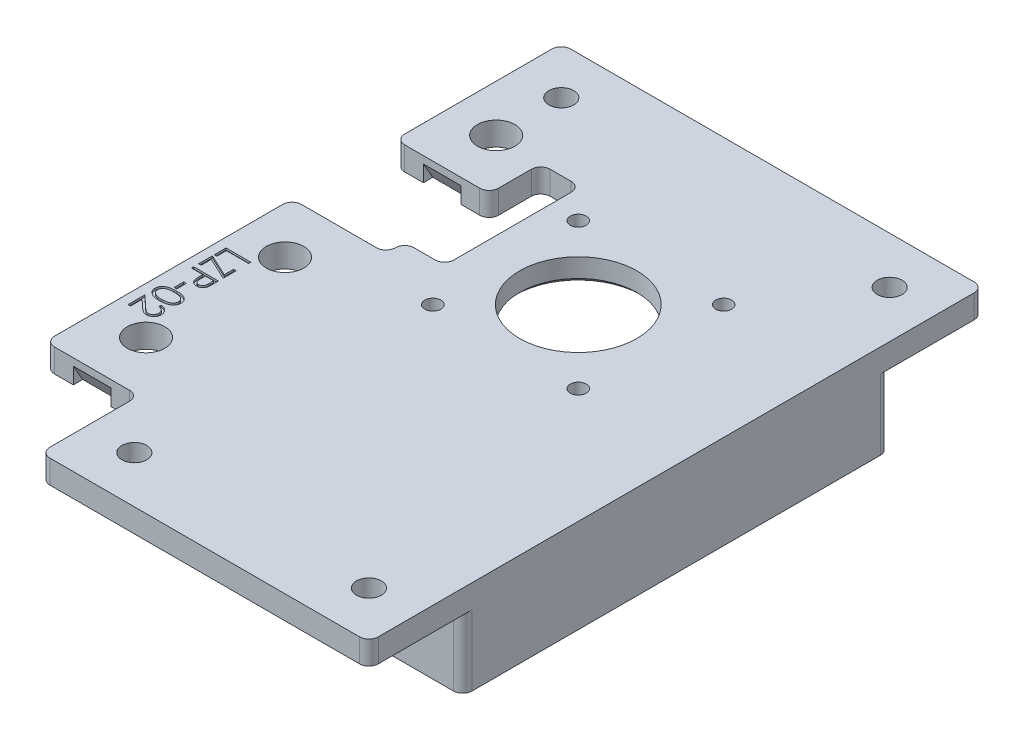
from build123d import *

# Parameters (mm, degrees)
SKETCH1_W               = 90
SKETCH1_H               = 131
BOSS_EXTRUDE1_DEPTH     = 5
CUT_EXTRUDE1_REACH      = 161.016
SKETCH2_R               = 12.5
SKETCH2_R_2             = 1.7
SKETCH2_W               = 20
SKETCH2_H               = 20
M5_CLEARANCE_HOLE1_D    = 5.3
SKETCH6_R               = 4
CUT_EXTRUDE2_DEPTH      = 10
MOVE_FACE1_BY           = 1
MOVE_FACE1_2_BY         = 1
MOVE_FACE1_3_BY         = 1
BOSS_EXTRUDE2_DEPTH     = 15
FILLET4_R               = 3
FILLET5_R               = 2
CUT_EXTRUDE5_DEPTH      = 4
CUT_EXTRUDE5_DEPTH_BACK = 4
SKETCH11_W              = 8.5
SKETCH11_H              = 15
CUT_EXTRUDE6_DEPTH      = 161.190511579
FILLET6_R               = 2
CHAMFER1_SIZE           = 1
SKETCH12_W              = 0.542735043
SKETCH12_H              = 2.03525641
CUT_EXTRUDE7_DEPTH      = 0.4


# Some blends are built 0.0001 mm under size
with BuildPart() as part:
    # Sketch1 → Boss-Extrude1 (new body)
    with BuildSketch(Plane(origin=(0, 0, 0), x_dir=(1, 0, 0), z_dir=(0, 1, 0))):
        with Locations((45, 65.5)):
            Rectangle(SKETCH1_W, SKETCH1_H)
    extrude(amount=BOSS_EXTRUDE1_DEPTH)

    # Sketch2 → Cut-Extrude1 (cut, up to next)
    with BuildSketch(Plane(origin=(0, 5, 0), x_dir=(1, 0, 0), z_dir=(0, 1, 0)), mode=Mode.PRIVATE) as cut_extrude1_sk1:
        with Locations(Location((50, 84.625, 0), (0, 0, 270))):
            Circle(SKETCH2_R)
    cut_extrude1_tool1 = extrude(cut_extrude1_sk1.sketch, amount=-CUT_EXTRUDE1_REACH, mode=Mode.PRIVATE) & part.part
    # Sketch2 → Cut-Extrude1 (cut, up to next)
    with BuildSketch(Plane(origin=(0, 5, 0), x_dir=(1, 0, 0), z_dir=(0, 1, 0)), mode=Mode.PRIVATE) as cut_extrude1_sk2:
        with Locations(Location((65.5, 100.125, 0), (0, 0, 270))):
            Circle(SKETCH2_R_2)
    cut_extrude1_tool2 = extrude(cut_extrude1_sk2.sketch, amount=-CUT_EXTRUDE1_REACH, mode=Mode.PRIVATE) & part.part
    # Sketch2 → Cut-Extrude1 (cut, up to next)
    with BuildSketch(Plane(origin=(0, 5, 0), x_dir=(1, 0, 0), z_dir=(0, 1, 0)), mode=Mode.PRIVATE) as cut_extrude1_sk3:
        with Locations(Location((34.5, 100.125, 0), (0, 0, 270))):
            Circle(SKETCH2_R_2)
    cut_extrude1_tool3 = extrude(cut_extrude1_sk3.sketch, amount=-CUT_EXTRUDE1_REACH, mode=Mode.PRIVATE) & part.part
    # Sketch2 → Cut-Extrude1 (cut, up to next)
    with BuildSketch(Plane(origin=(0, 5, 0), x_dir=(1, 0, 0), z_dir=(0, 1, 0)), mode=Mode.PRIVATE) as cut_extrude1_sk4:
        with Locations(Location((65.5, 69.125, 0), (0, 0, 270))):
            Circle(SKETCH2_R_2)
    cut_extrude1_tool4 = extrude(cut_extrude1_sk4.sketch, amount=-CUT_EXTRUDE1_REACH, mode=Mode.PRIVATE) & part.part
    # Sketch2 → Cut-Extrude1 (cut, up to next)
    with BuildSketch(Plane(origin=(0, 5, 0), x_dir=(1, 0, 0), z_dir=(0, 1, 0)), mode=Mode.PRIVATE) as cut_extrude1_sk5:
        with Locations(Location((34.5, 69.125, 0), (0, 0, 270))):
            Circle(SKETCH2_R_2)
    cut_extrude1_tool5 = extrude(cut_extrude1_sk5.sketch, amount=-CUT_EXTRUDE1_REACH, mode=Mode.PRIVATE) & part.part
    # Sketch2 → Cut-Extrude1 (cut, up to next)
    with BuildSketch(Plane(origin=(0, 5, 0), x_dir=(1, 0, 0), z_dir=(0, 1, 0)), mode=Mode.PRIVATE) as cut_extrude1_sk6:
        Polygon((0, 94.625), (20, 94.625), (20, 91.625), (28.5, 91.625), (28.5, 77.625), (20, 77.625), (20, 74.625), (0, 74.625), align=None)
    cut_extrude1_tool6 = extrude(cut_extrude1_sk6.sketch, amount=-CUT_EXTRUDE1_REACH, mode=Mode.PRIVATE) & part.part
    # Sketch2 → Cut-Extrude1 (cut, up to next)
    with BuildSketch(Plane(origin=(0, 5, 0), x_dir=(1, 0, 0), z_dir=(0, 1, 0)), mode=Mode.PRIVATE) as cut_extrude1_sk7:
        with Locations((10, 10)):
            Rectangle(SKETCH2_W, SKETCH2_H)
    cut_extrude1_tool7 = extrude(cut_extrude1_sk7.sketch, amount=-CUT_EXTRUDE1_REACH, mode=Mode.PRIVATE) & part.part
    add(cut_extrude1_tool1.solids().sort_by_distance((50, 5, -84.625))[0], mode=Mode.SUBTRACT)
    add(cut_extrude1_tool2.solids().sort_by_distance((65.5, 5, -100.125))[0], mode=Mode.SUBTRACT)
    add(cut_extrude1_tool3.solids().sort_by_distance((34.5, 5, -100.125))[0], mode=Mode.SUBTRACT)
    add(cut_extrude1_tool4.solids().sort_by_distance((65.5, 5, -69.125))[0], mode=Mode.SUBTRACT)
    add(cut_extrude1_tool5.solids().sort_by_distance((34.5, 5, -69.125))[0], mode=Mode.SUBTRACT)
    add(cut_extrude1_tool6.solids().sort_by_distance((13.267341, 5, -84.625))[0], mode=Mode.SUBTRACT)
    add(cut_extrude1_tool7.solids().sort_by_distance((10, 5, -10))[0], mode=Mode.SUBTRACT)

    # M5 Clearance Hole1 (through all)
    with Locations(Plane(origin=(0, 5, 0), x_dir=(1, 0, 0), z_dir=(0, 1, 0))):
        with Locations((80, 10), (10, 121), (80, 121), (30, 10)):
            Hole(M5_CLEARANCE_HOLE1_D / 2)

    # Sketch6 → Cut-Extrude2 (cut)
    with BuildSketch(Plane(origin=(0, 0, 0), x_dir=(-1, 0, 0), z_dir=(0, -1, 0))):
        with Locations(Location((-10, 32.5, 0), (0, 0, 90))):
            Circle(SKETCH6_R)
        with Locations(Location((-10, 62.125, 0), (0, 0, 90))):
            Circle(SKETCH6_R)
        with Locations(Location((-10, 107.125, 0), (0, 0, 90))):
            Circle(SKETCH6_R)
    extrude(amount=-CUT_EXTRUDE2_DEPTH, mode=Mode.SUBTRACT)

    # Move Face1: a face moved inward by 1.0
    extrude(part.faces().sort_by_distance((10, 2.5, -20))[0], amount=MOVE_FACE1_BY, dir=(0, 0, -1), mode=Mode.SUBTRACT)

    # Move Face1 2: a face moved inward by 1.0
    extrude(part.faces().sort_by_distance((10, 2.5, -94.625))[0], amount=MOVE_FACE1_2_BY, dir=(0, 0, -1), mode=Mode.SUBTRACT)

    # Move Face1 3: a face moved inward by 1.0
    extrude(part.faces().sort_by_distance((10, 2.5, -74.625))[0], amount=MOVE_FACE1_3_BY, dir=(0, 0, 1), mode=Mode.SUBTRACT)

    # Sketch9 → Boss-Extrude2 (add)
    with BuildSketch(Plane.XZ):
        Polygon((90, -111), (90, -20), (20, -20), (20, -73.625), (25, -73.625), (25, -25), (85, -25), (85, -106), (71, -106), (71, -111), align=None)
    extrude(amount=BOSS_EXTRUDE2_DEPTH)

    # Fillet4
    fillet4_edges = [part.edges().sort_by_distance(p)[0] for p in [
        (25, -7.5, -25),
        (85, -7.5, -25),
        (85, -7.5, -106),
    ]]
    fillet(fillet4_edges, radius=FILLET4_R)

    # Fillet5
    # the kernel refuses this fillet: 2 mm, written as the material it takes off along each edge
    with BuildSketch(Plane(origin=(71, 0, -111), x_dir=(0, 0, 1), z_dir=(0, -1, 0)), Plane(origin=(90, 0, -111), x_dir=(-1, 0, 0), z_dir=(0, -1, 0)), Plane(origin=(90, 0, -20), x_dir=(0, 0, -1), z_dir=(0, -1, 0)), Plane(origin=(20, 0, -20), x_dir=(1, 0, 0), z_dir=(0, -1, 0)), Plane(origin=(71, 0, -106), x_dir=(1, 0, 0), z_dir=(0, -1, 0))) as fillet5_piece_1:
        with BuildLine():
            CenterArc((FILLET5_R, -FILLET5_R), FILLET5_R, 90, 90)
            Line((0, -FILLET5_R), (0, 0))
            Line((0, 0), (FILLET5_R, 0))
        make_face()
    extrude(amount=20, mode=Mode.SUBTRACT)
    with BuildSketch(Plane(origin=(20, 0, -73.625), x_dir=(1, 0, 0), z_dir=(0, -1, 0)), Plane(origin=(25, 0, -73.625), x_dir=(0, 0, 1), z_dir=(0, -1, 0))) as fillet5_piece_2:
        with BuildLine():
            CenterArc((FILLET5_R, FILLET5_R), FILLET5_R, 180, 90)
            Line((0, FILLET5_R), (0, 0))
            Line((0, 0), (FILLET5_R, 0))
        make_face()
    extrude(amount=20, mode=Mode.SUBTRACT)

    # Sketch10 → Cut-Extrude5 (cut, two sides: drawn at the far end of the back side and taken through both)
    with BuildSketch(Plane.ZY.offset(-10).offset(-CUT_EXTRUDE5_DEPTH_BACK)):
        Polygon((-73.625, 0), (-73.625, 3.464101615), (-71.625, 0), align=None)
        Polygon((-97.625, 0), (-95.625, 0), (-95.625, 3.464101615), align=None)
        Polygon((-21, 0), (-23, 0), (-21, 3.464101615), align=None)
    extrude(amount=CUT_EXTRUDE5_DEPTH + CUT_EXTRUDE5_DEPTH_BACK, mode=Mode.SUBTRACT)

    # Sketch11 → Cut-Extrude6 (cut, through all)
    with BuildSketch(Plane(origin=(0, 5, 0), x_dir=(1, 0, 0), z_dir=(0, 1, 0))):
        with Locations((24.25, 99.125)):
            Rectangle(SKETCH11_W, SKETCH11_H)
    extrude(amount=-CUT_EXTRUDE6_DEPTH, mode=Mode.SUBTRACT)

    # Fillet6
    fillet6_edges = [part.edges().sort_by_distance(p)[0] for p in [
        (20, 2.5, -106.625),
        (28.5, 2.5, -106.625),
        (0, 2.5, -21),
        (20, 2.5, -21),
        (20, 2.5, 0),
        (0, 2.5, -73.625),
        (0, 2.5, -95.625),
        (20, 2.5, -95.625),
        (28.5, 2.5, -77.625),
        (20, 2.5, -77.625),
        (20, 2.5, -73.625),
        (0, 2.5, -131),
        (90, 2.5, -131),
        (90, 2.5, 0),
    ]]
    fillet(fillet6_edges, radius=FILLET6_R - 0.0001)  # a hair under: the kernel refuses the full size

    # Chamfer1
    chamfer1_edges = [part.edges().sort_by_distance(p)[0] for p in [
        (50, 0, -97.125),
    ]]
    chamfer(chamfer1_edges, length=CHAMFER1_SIZE)

    # Sketch12 → Cut-Extrude7 (cut)
    # profile 1 of 6: a face of its own
    with BuildSketch(Plane(origin=(0, 5, 0), x_dir=(1, 0, 0), z_dir=(0, 1, 0))):
        Polygon((7.291666667, 57.556623932), (7.291666667, 57.081730769), (2.542735043, 57.081730769), (2.542735043, 55.046474359), (2, 55.046474359), (2, 57.556623932), align=None)
    # profile 2 of 6: a face of its own
    with BuildSketch(Plane(origin=(0, 5, 0), x_dir=(1, 0, 0), z_dir=(0, 1, 0))):
        Polygon((6.748931624, 54.435897436), (7.291666667, 54.435897436), (7.291666667, 51.654380342), (2.542735043, 53.874081864), (2.542735043, 51.722222222), (2, 51.722222222), (2, 54.639423077), (6.748931624, 52.419721554), align=None)
    # profile 3 of 6: a face of its own
    with BuildSketch(Plane(origin=(0, 5, 0), x_dir=(1, 0, 0), z_dir=(0, 1, 0))):
        with BuildLine():
            Line((7.291666667, 50.636752137), (7.291666667, 49.598983373))
            add(Edge.make_bspline(
                [(7.291666667, 49.598983373), (7.291588204, 49.52760498), (7.291437867, 49.390840807), (7.286879859, 49.194723997), (7.280791884, 49.016606902), (7.272352593, 48.856873588), (7.262379177, 48.715032583), (7.248390974, 48.591725713), (7.233785528, 48.485983765), (7.218936496, 48.422625205), (7.212164463, 48.393729968)],
                knots=[0, 0, 0, 0, 1.415646017, 2.712440637, 3.8905458, 4.950247383, 5.884950622, 6.709939814, 7.411656543, 8, 8, 8, 8], degree=3))
            add(Edge.make_bspline(
                [(7.212164463, 48.393729968), (7.202152795, 48.357151563), (7.182365371, 48.284856676), (7.142731425, 48.180686111), (7.095742949, 48.081570302), (7.042167591, 47.987196876), (6.979813317, 47.898623436), (6.910652572, 47.814716183), (6.834723407, 47.734993849), (6.750553877, 47.662164576), (6.66124729, 47.595115881), (6.564814737, 47.537598271), (6.463355039, 47.488945967), (6.355829122, 47.449211852), (6.242890501, 47.418998598), (6.124209473, 47.396676092), (6.000193835, 47.382393875), (5.915434848, 47.381034093), (5.872287326, 47.38034188)],
                knots=[0, 0, 0, 0, 0.999487232, 1.975422798, 2.933948774, 3.889618007, 4.832992075, 5.786114792, 6.754729845, 7.731954186, 8.717668599, 9.695514499, 10.68728626, 11.680675814, 12.71351902, 13.766008651, 14.862761406, 16, 16, 16, 16], degree=3))
            add(Edge.make_bspline(
                [(5.872287326, 47.38034188), (5.828778069, 47.380979034), (5.743649267, 47.382225669), (5.619109456, 47.39718791), (5.500094748, 47.41734189), (5.386869031, 47.448331481), (5.280104711, 47.488919582), (5.178170229, 47.536532567), (5.082799773, 47.593960048), (4.993647107, 47.659946873), (4.910628549, 47.73335226), (4.834345705, 47.813865631), (4.765245098, 47.901161942), (4.703171817, 47.994963761), (4.649565299, 48.096185557), (4.601551279, 48.203292146), (4.561227175, 48.317214497), (4.540015058, 48.396049012), (4.529230101, 48.436131143)],
                knots=[0, 0, 0, 0, 1.121902311, 2.195077645, 3.232258892, 4.234102512, 5.217864754, 6.176164875, 7.132989551, 8.084763148, 9.034132444, 9.988522005, 10.94243251, 11.903244335, 12.886203696, 13.894208494, 14.929344452, 16, 16, 16, 16], degree=3))
            add(Edge.make_bspline(
                [(4.529230101, 48.436131143), (4.522180118, 48.469283184), (4.50672967, 48.541937809), (4.48948117, 48.661594067), (4.474758845, 48.800909115), (4.46372022, 48.9596928), (4.454270258, 49.137802597), (4.446758973, 49.335334855), (4.442631694, 49.552677329), (4.442418829, 49.7042779), (4.442307692, 49.783428486)],
                knots=[0, 0, 0, 0, 0.601384939, 1.31797006, 2.144135048, 3.087295005, 4.142315834, 5.309527816, 6.595305764, 8, 8, 8, 8], degree=3))
            Line((4.442307692, 49.783428486), (4.442307692, 50.161858974))
            Line((4.442307692, 50.161858974), (2, 50.161858974))
            Line((2, 50.161858974), (2, 50.636752137))
            Line((2, 50.636752137), (7.291666667, 50.636752137))
        make_face()
        with BuildLine():
            Line((6.748931624, 50.161858974), (4.985042735, 50.161858974))
            Line((4.985042735, 50.161858974), (4.973382412, 49.235393296))
            add(Edge.make_bspline(
                [(4.973382412, 49.235393296), (4.973354123, 49.190156775), (4.973299513, 49.102828605), (4.979407465, 48.976334594), (4.986144945, 48.859278395), (4.996696128, 48.751405801), (5.010598304, 48.653541183), (5.025730557, 48.564427502), (5.046231747, 48.485369336), (5.074817398, 48.392727642), (5.122620583, 48.289846912), (5.193796037, 48.178666681), (5.282030895, 48.08291784), (5.382600659, 48.000614523), (5.49488718, 47.936829671), (5.614084563, 47.888855329), (5.740267811, 47.860910551), (5.826573075, 47.85713974), (5.870167268, 47.855235043)],
                knots=[0, 0, 0, 0, 1.160368111, 2.240066715, 3.248291599, 4.168343349, 5.019594299, 5.784185847, 6.485545725, 7.113397927, 8.269509094, 9.383373363, 10.487084095, 11.595623793, 12.704274681, 13.786671823, 14.88201193, 16, 16, 16, 16], degree=3))
            add(Edge.make_bspline(
                [(5.870167268, 47.855235043), (5.912706714, 47.857149911), (5.997269869, 47.860956433), (6.121262723, 47.889075755), (6.239195467, 47.93673602), (6.350099601, 48.001046739), (6.450257782, 48.080986866), (6.536501316, 48.174613823), (6.606774651, 48.280015809), (6.651819116, 48.378113007), (6.679367747, 48.465192781), (6.698634582, 48.540838214), (6.71401981, 48.626246141), (6.726476944, 48.72144761), (6.73714117, 48.825703719), (6.744377092, 48.939910474), (6.748612633, 49.063635144), (6.748822719, 49.149527317), (6.748931624, 49.19405215)],
                knots=[0, 0, 0, 0, 1.120550889, 2.227516482, 3.330715807, 4.461473166, 5.594337325, 6.694900473, 7.802844763, 8.919519911, 9.52614448, 10.208195984, 10.975273469, 11.811520316, 12.738076669, 13.736566072, 14.826679847, 16, 16, 16, 16], degree=3))
            Line((6.748931624, 49.19405215), (6.748931624, 50.161858974))
        make_face(mode=Mode.SUBTRACT)
    # profile 4 of 6: a face of its own
    with BuildSketch(Plane(origin=(0, 5, 0), x_dir=(1, 0, 0), z_dir=(0, 1, 0))):
        with Locations((4.035256411, 45.752136752)):
            Rectangle(SKETCH12_W, SKETCH12_H)
    # profile 5 of 6: a face of its own
    with BuildSketch(Plane(origin=(0, 5, 0), x_dir=(1, 0, 0), z_dir=(0, 1, 0))):
        with BuildLine():
            add(Edge.make_bspline(
                [(4.643713275, 44.327457265), (4.728527182, 44.326961333), (4.89327942, 44.325997977), (5.133346677, 44.31528096), (5.358560448, 44.297477765), (5.568931508, 44.27307959), (5.764514188, 44.243388847), (5.944785745, 44.203753484), (6.11058076, 44.158679512), (6.262439122, 44.106439014), (6.40240934, 44.047494882), (6.533070555, 43.983332352), (6.654256881, 43.911440079), (6.767788862, 43.835804078), (6.872399426, 43.753660409), (6.967890466, 43.665875484), (7.054319642, 43.571578514), (7.132715607, 43.472634476), (7.201008487, 43.368418073), (7.262544911, 43.262141949), (7.313051617, 43.151930775), (7.354551921, 43.038789712), (7.387805062, 42.923047786), (7.410832799, 42.804226761), (7.425264999, 42.682297931), (7.426648689, 42.60000371), (7.427350427, 42.558268229)],
                knots=[0, 0, 0, 0, 1.646377244, 3.198111528, 4.663803227, 6.031090796, 7.308794487, 8.502186765, 9.612154809, 10.642545331, 11.617106989, 12.558866172, 13.465886467, 14.35053239, 15.20542558, 16.045215227, 16.865619885, 17.686225247, 18.492864914, 19.282407821, 20.068097601, 20.842842034, 21.620163247, 22.403093475, 23.190129512, 24, 24, 24, 24], degree=3))
            add(Edge.make_bspline(
                [(7.427350427, 42.558268229), (7.426612897, 42.516183637), (7.425146182, 42.432490623), (7.411049269, 42.30875577), (7.387658404, 42.187879466), (7.354515978, 42.070377042), (7.313398705, 41.955283312), (7.261862231, 41.843498505), (7.201871562, 41.734328275), (7.1313807, 41.629507483), (7.052788449, 41.527885386), (6.96394489, 41.431958109), (6.8657471, 41.341716919), (6.759245711, 41.256029255), (6.642398023, 41.17732615), (6.517236333, 41.102375842), (6.381571812, 41.035289549), (6.237668009, 40.97067879), (6.081543192, 40.914909179), (5.914077423, 40.864613785), (5.73329264, 40.823975344), (5.540137365, 40.790124897), (5.333902241, 40.763901066), (5.115029359, 40.744801714), (4.883374721, 40.734712645), (4.72499083, 40.732812633), (4.643713275, 40.731837607)],
                knots=[0, 0, 0, 0, 0.810914788, 1.612654377, 2.396697861, 3.181598691, 3.963628158, 4.749916497, 5.551656086, 6.361998678, 7.18212741, 8.025565596, 8.878627764, 9.750805457, 10.657531673, 11.591944965, 12.560506719, 13.57287815, 14.630710178, 15.753379473, 16.941251878, 18.199788006, 19.531962791, 20.947069417, 22.433333509, 24, 24, 24, 24], degree=3))
            add(Edge.make_bspline(
                [(4.643713275, 40.731837607), (4.562790526, 40.732823958), (4.40511585, 40.734745824), (4.174499362, 40.74467538), (3.956802721, 40.764326695), (3.751419943, 40.788632271), (3.559570451, 40.823255229), (3.379429989, 40.86261543), (3.212553139, 40.911535935), (3.057251711, 40.966545404), (2.914052944, 41.029754174), (2.779561178, 41.097433385), (2.654501615, 41.171923633), (2.537655626, 41.251096105), (2.430230593, 41.336055435), (2.331961019, 41.426678742), (2.242911721, 41.523035007), (2.163245654, 41.624886861), (2.093575355, 41.731356631), (2.031301313, 41.840162465), (1.980769791, 41.953476029), (1.938105046, 42.06877902), (1.904886375, 42.187159399), (1.882141775, 42.308501048), (1.866145909, 42.43240658), (1.864928241, 42.516169077), (1.864316239, 42.558268229)],
                knots=[0, 0, 0, 0, 1.56130642, 3.042141888, 4.451772327, 5.777565838, 7.030558081, 8.211376819, 9.333164717, 10.383253789, 11.387583522, 12.350962576, 13.286244149, 14.193812918, 15.072134482, 15.925989337, 16.770211267, 17.600669898, 18.417446232, 19.22325363, 20.01647746, 20.807971184, 21.593601364, 22.38506573, 23.188331689, 24, 24, 24, 24], degree=3))
            add(Edge.make_bspline(
                [(1.864316239, 42.558268229), (1.86502473, 42.600002014), (1.866421736, 42.682292893), (1.880756398, 42.804246213), (1.904131403, 42.922881925), (1.935874544, 43.038437189), (1.976218194, 43.151148492), (2.027533821, 43.259911716), (2.087051966, 43.366163247), (2.154764994, 43.469418259), (2.232362361, 43.567708771), (2.318182744, 43.661597931), (2.414378694, 43.748715073), (2.519410446, 43.829829221), (2.632386805, 43.906802142), (2.754420675, 43.977989923), (2.886306107, 44.042027302), (3.027049005, 44.10229242), (3.180023449, 44.155416007), (3.346702747, 44.20198716), (3.528008928, 44.24081073), (3.723403748, 44.272032846), (3.933033452, 44.29777234), (4.157267135, 44.315196659), (4.395911334, 44.326006512), (4.559605307, 44.326964856), (4.643713275, 44.327457265)],
                knots=[0, 0, 0, 0, 0.810940842, 1.599017053, 2.38298203, 3.159479784, 3.926441347, 4.70693857, 5.494146311, 6.292334103, 7.104379492, 7.925868426, 8.762126819, 9.623561095, 10.503686106, 11.41783325, 12.366995289, 13.351843594, 14.392337808, 15.512229747, 16.713911458, 17.994391108, 19.357476964, 20.818259213, 22.365182633, 24, 24, 24, 24], degree=3))
        make_face()
        with BuildLine():
            add(Edge.make_bspline(
                [(4.645833333, 43.852564103), (4.575153753, 43.85238351), (4.437978566, 43.852033015), (4.238644112, 43.842876616), (4.052724686, 43.830403053), (3.879984223, 43.814314421), (3.721007406, 43.790421882), (3.574700904, 43.763650858), (3.441838752, 43.731072353), (3.321510019, 43.692525804), (3.211669987, 43.648623193), (3.109468835, 43.600680878), (3.013667462, 43.549205788), (2.925238891, 43.491496754), (2.84330288, 43.428862741), (2.768094889, 43.3612009), (2.69994307, 43.288630228), (2.61907433, 43.188168628), (2.534518776, 43.056193752), (2.461794543, 42.889057466), (2.415796233, 42.717242513), (2.409962886, 42.600591784), (2.407051282, 42.542367788)],
                knots=[0, 0, 0, 0, 1.459116078, 2.831857795, 4.118796693, 5.306371758, 6.412361096, 7.436813035, 8.376339383, 9.234574298, 10.043323891, 10.816788787, 11.564361537, 12.286735248, 12.994408768, 13.691741332, 14.372975427, 15.047457468, 16.352811911, 17.594285292, 18.799233213, 20, 20, 20, 20], degree=3))
            add(Edge.make_bspline(
                [(2.407051282, 42.542367788), (2.409466974, 42.48376988), (2.414293372, 42.366695046), (2.460858129, 42.195647523), (2.531115647, 42.029594614), (2.614191043, 41.899462038), (2.693306493, 41.800458669), (2.760759592, 41.729524648), (2.836288106, 41.664418932), (2.917778708, 41.602669604), (3.006788297, 41.546035049), (3.102888858, 41.494534829), (3.206347257, 41.447539768), (3.278570554, 41.420765377), (3.315496461, 41.407076322)],
                knots=[0, 0, 0, 0, 1.353760809, 2.704726607, 4.075137775, 5.516104923, 6.260822281, 7.007110065, 7.778089737, 8.566572457, 9.372053459, 10.217411131, 11.088608312, 12, 12, 12, 12], degree=3))
            add(Edge.make_bspline(
                [(3.315496461, 41.407076322), (3.362712853, 41.391123054), (3.458582377, 41.358731078), (3.607298851, 41.316984705), (3.763331602, 41.284107733), (3.925748147, 41.254529787), (4.095746266, 41.234341238), (4.272799966, 41.218091568), (4.45704274, 41.208520172), (4.582220881, 41.207333704), (4.645833333, 41.206730769)],
                knots=[0, 0, 0, 0, 0.884706709, 1.796334032, 2.740027952, 3.714592787, 4.726048262, 5.777819803, 6.87074269, 8, 8, 8, 8], degree=3))
            add(Edge.make_bspline(
                [(4.645833333, 41.206730769), (4.709444418, 41.207395741), (4.833896691, 41.20869673), (5.01597048, 41.217244341), (5.189203532, 41.230979642), (5.353753001, 41.24957007), (5.509326007, 41.275090797), (5.656145172, 41.30573865), (5.794170917, 41.341669741), (5.923759196, 41.382883773), (6.044444237, 41.429331417), (6.156488793, 41.480642137), (6.260486858, 41.535397627), (6.356139919, 41.594881444), (6.44387973, 41.65837439), (6.521946286, 41.727555581), (6.592759329, 41.799680015), (6.673589639, 41.900701247), (6.756006133, 42.032954038), (6.831851983, 42.197518292), (6.875407378, 42.368772718), (6.881548262, 42.484544488), (6.884615385, 42.542367788)],
                knots=[0, 0, 0, 0, 1.313668642, 2.570134578, 3.763346207, 4.902004944, 5.98888779, 7.017888835, 7.998425394, 8.933058446, 9.82474457, 10.667209444, 11.476765193, 12.250262638, 12.991704352, 13.7104269, 14.401925311, 15.076585796, 16.378385137, 17.609787933, 18.806186071, 20, 20, 20, 20], degree=3))
            add(Edge.make_bspline(
                [(6.884615385, 42.542367788), (6.881547988, 42.600896974), (6.875407606, 42.718061973), (6.831966197, 42.891059153), (6.756712275, 43.056795675), (6.673057421, 43.187987414), (6.594190254, 43.288881189), (6.525607065, 43.36012628), (6.450171558, 43.426733022), (6.368582443, 43.489419216), (6.280109272, 43.547072697), (6.18432183, 43.598568852), (6.082111181, 43.646483647), (5.97229614, 43.690480515), (5.851786005, 43.728669838), (5.719594394, 43.762804048), (5.573151236, 43.78955883), (5.413729962, 43.812906186), (5.240777147, 43.830707221), (5.054429089, 43.842844595), (4.854749922, 43.852049582), (4.716866968, 43.852389161), (4.645833333, 43.852564103)],
                knots=[0, 0, 0, 0, 1.207964612, 2.418129846, 3.655795183, 4.951004962, 5.620895151, 6.296795572, 6.989224116, 7.696855977, 8.419187164, 9.166715907, 9.940135271, 10.748837255, 11.607021648, 12.548275234, 13.5654991, 14.678641405, 15.874140913, 17.15372626, 18.533675393, 20, 20, 20, 20], degree=3))
        make_face(mode=Mode.SUBTRACT)
    # profile 6 of 6: a face of its own
    with BuildSketch(Plane(origin=(0, 5, 0), x_dir=(1, 0, 0), z_dir=(0, 1, 0))):
        with BuildLine():
            Line((5.663461538, 39.578525641), (5.663461538, 40.053418803))
            add(Edge.make_bspline(
                [(5.663461538, 40.053418803), (5.726464263, 40.05032423), (5.850199936, 40.04424657), (6.030601924, 40.015772535), (6.203057822, 39.975067474), (6.366089137, 39.917378907), (6.521643416, 39.846138567), (6.667655077, 39.758919776), (6.805573268, 39.657581895), (6.932786742, 39.542310834), (7.049075763, 39.417231109), (7.150559973, 39.283092142), (7.235323177, 39.141272628), (7.306568605, 38.993002649), (7.359982016, 38.836567419), (7.399631298, 38.673462283), (7.423482359, 38.502950023), (7.426046401, 38.386775358), (7.427350427, 38.327690972)],
                knots=[0, 0, 0, 0, 1.100776268, 2.161895295, 3.184016182, 4.190939212, 5.176500551, 6.166955529, 7.155448256, 8.160289653, 9.16017456, 10.133824356, 11.091467644, 12.04088621, 13.000931625, 13.972173743, 14.968683325, 16, 16, 16, 16], degree=3))
            add(Edge.make_bspline(
                [(7.427350427, 38.327690972), (7.425992047, 38.269666979), (7.423322877, 38.155651906), (7.400400845, 37.989248622), (7.364499772, 37.830835332), (7.314130035, 37.680721685), (7.246420246, 37.540105373), (7.165083492, 37.407930055), (7.071013032, 37.282622163), (6.960260243, 37.169823811), (6.842025685, 37.06624612), (6.715799926, 36.976889139), (6.585429459, 36.900366856), (6.449920154, 36.836583102), (6.307996099, 36.789629178), (6.161723542, 36.753981173), (6.009588411, 36.733831393), (5.906617786, 36.730738907), (5.854266827, 36.729166667)],
                knots=[0, 0, 0, 0, 1.111607364, 2.184268762, 3.212621178, 4.221274766, 5.211760367, 6.196651075, 7.1921475, 8.207485113, 9.220403448, 10.201281604, 11.166441695, 12.114753415, 13.065576456, 14.026450734, 14.996634279, 16, 16, 16, 16], degree=3))
            add(Edge.make_bspline(
                [(5.854266827, 36.729166667), (5.780564744, 36.731726719), (5.634453944, 36.736801898), (5.419740997, 36.780215301), (5.211712852, 36.848018954), (5.044288597, 36.929657815), (4.909376053, 37.012014963), (4.798298368, 37.086230599), (4.678698434, 37.173111921), (4.550976745, 37.273923459), (4.414132877, 37.386579825), (4.268249496, 37.51210143), (4.114833844, 37.651383361), (4.010050375, 37.749140856), (3.955754207, 37.799796341)],
                knots=[0, 0, 0, 0, 1.184426356, 2.348067706, 3.509069118, 4.696110526, 5.333549288, 6.050745305, 6.844228056, 7.710549037, 8.667450064, 9.695053472, 10.805634456, 12, 12, 12, 12], degree=3))
            Line((3.955754207, 37.799796341), (2.542735043, 39.123773037))
            Line((2.542735043, 39.123773037), (2.542735043, 36.661324786))
            Line((2.542735043, 36.661324786), (2, 36.661324786))
            Line((2, 36.661324786), (2, 40.256944444))
            Line((2, 40.256944444), (4.1900207, 38.204727564))
            add(Edge.make_bspline(
                [(4.1900207, 38.204727564), (4.242176009, 38.154758769), (4.342355684, 38.058778941), (4.488659254, 37.923082776), (4.624227726, 37.801009757), (4.749661836, 37.692478907), (4.864250491, 37.597400925), (4.968891695, 37.51608002), (5.062687447, 37.448156768), (5.172874774, 37.376172276), (5.307566636, 37.307530285), (5.471339175, 37.247200999), (5.640302989, 37.21067847), (5.754449153, 37.206274875), (5.811865652, 37.204059829)],
                knots=[0, 0, 0, 0, 1.329530082, 2.553755191, 3.672934919, 4.687409497, 5.60679272, 6.413407421, 7.126401618, 7.737995624, 8.834647426, 9.90044882, 10.943907757, 12, 12, 12, 12], degree=3))
            add(Edge.make_bspline(
                [(5.811865652, 37.204059829), (5.847976042, 37.205011138), (5.919142686, 37.206885984), (6.023415573, 37.223745833), (6.124388935, 37.248516297), (6.220814308, 37.286695234), (6.314588193, 37.332565821), (6.402859571, 37.391168878), (6.488637402, 37.458136783), (6.568980435, 37.535816269), (6.642587128, 37.621093911), (6.707785242, 37.711197667), (6.76227331, 37.806522656), (6.806940166, 37.906671617), (6.841979162, 38.011364116), (6.866258197, 38.120802972), (6.881501955, 38.234685707), (6.883564452, 38.312448254), (6.884615385, 38.352071648)],
                knots=[0, 0, 0, 0, 0.991504627, 1.954065223, 2.895985987, 3.842598665, 4.797835564, 5.759220273, 6.74786863, 7.784730864, 8.824135544, 9.839918996, 10.835834653, 11.835434876, 12.84861661, 13.863796685, 14.911511676, 16, 16, 16, 16], degree=3))
            add(Edge.make_bspline(
                [(6.884615385, 38.352071648), (6.883534651, 38.393453924), (6.881412268, 38.474721881), (6.866556697, 38.594037337), (6.840953084, 38.707871748), (6.805851074, 38.816455547), (6.761657364, 38.919893353), (6.705550122, 39.017249882), (6.639719982, 39.109413968), (6.564677215, 39.196216337), (6.480732987, 39.275974095), (6.388309089, 39.347523284), (6.286804316, 39.408547179), (6.178511353, 39.462642116), (6.060550826, 39.504032749), (5.93578119, 39.539413063), (5.802429766, 39.565114245), (5.710553655, 39.573980926), (5.663461538, 39.578525641)],
                knots=[0, 0, 0, 0, 1.031212865, 2.025131798, 2.990757446, 3.934781266, 4.865570067, 5.788494791, 6.729227313, 7.684356718, 8.643577152, 9.610526866, 10.590658432, 11.59095419, 12.621640561, 13.700587263, 14.82141059, 16, 16, 16, 16], degree=3))
        make_face()
    extrude(amount=-CUT_EXTRUDE7_DEPTH, mode=Mode.SUBTRACT)


solid = part.part
